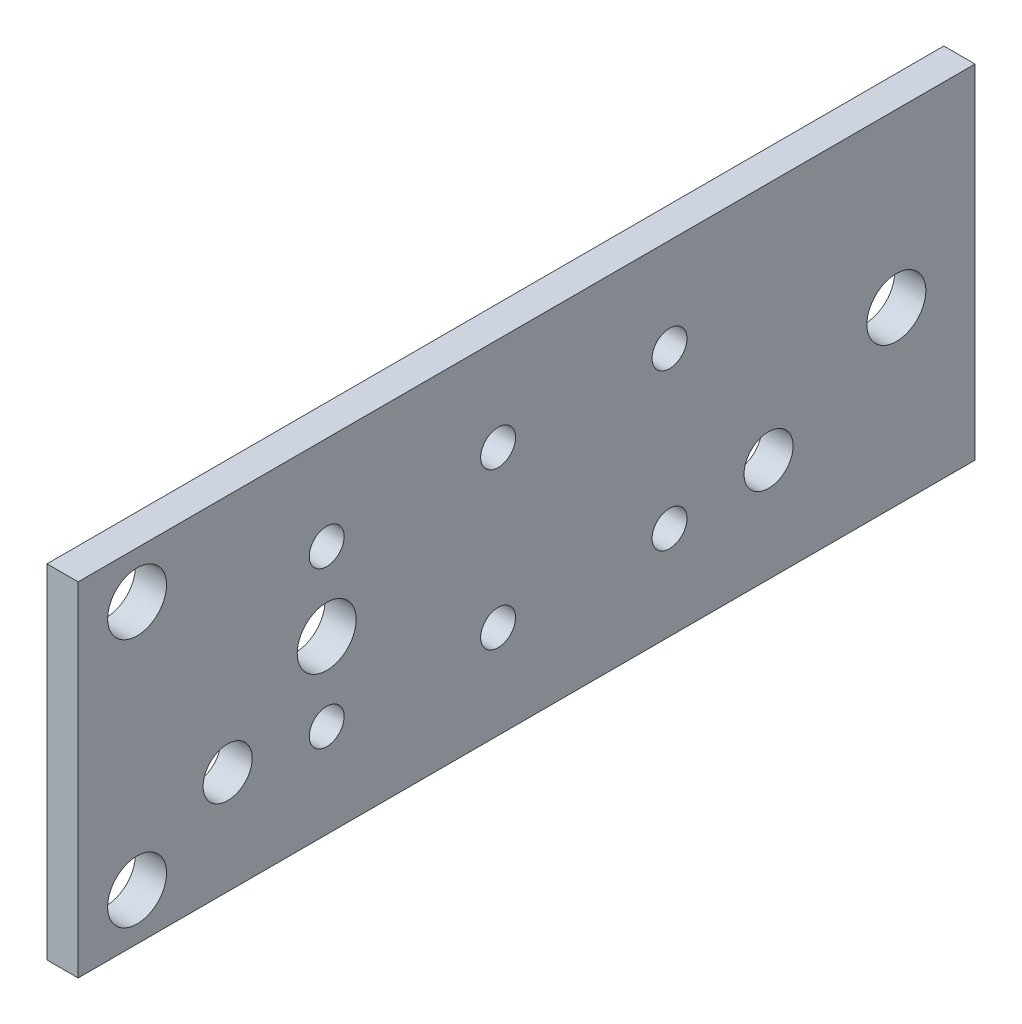
from build123d import *

# Parameters (mm, degrees)
SKETCH1_W                      = 38.1
SKETCH1_H                      = 120
BOSS_EXTRUDE1_DEPTH            = 38.1
SKETCH2_W                      = 34.925
SKETCH2_H                      = 34.925
CUT_EXTRUDE1_DEPTH             = 130.767142413
F_4_2_4_2_DIAMETER_HOLE1_D     = 4.2
F_6_0_6_DIAMETER_HOLE1_D       = 6
F_4_2_4_2_DIAMETER_HOLE2_D     = 4.2
F_4_2_4_2_DIAMETER_HOLE2_DEPTH = 38.1
F_6_0_6_DIAMETER_HOLE2_D       = 6
F_6_0_6_DIAMETER_HOLE2_DEPTH   = 38.1
F_6_0_6_DIAMETER_HOLE3_D       = 6
F_6_0_6_DIAMETER_HOLE3_DEPTH   = 38.1
F_4_2_4_2_DIAMETER_HOLE3_D     = 4.2
SKETCH15_R                     = 2.1
SKETCH15_R_2                   = 3
BOSS_EXTRUDE2_DEPTH            = 3.175
BOSS_EXTRUDE3_START            = -3.175
SKETCH16_R                     = 2.1
BOSS_EXTRUDE3_DEPTH            = 3.175
SKETCH18_W                     = 3.175
SKETCH18_H                     = 3.175
CUT_EXTRUDE2_DEPTH             = 130.767142413
CUT_EXTRUDE3_START             = -3.175
CUT_EXTRUDE3_OUTLINE_R         = 2.1
CUT_EXTRUDE3_DEPTH             = 3.175
BOSS_EXTRUDE4_START            = -3.175
BOSS_EXTRUDE4_OUTLINE_R        = 3
BOSS_EXTRUDE4_DEPTH            = 3.175
SKETCH19_R                     = 3
CUT_EXTRUDE4_DEPTH             = 121.228267267
BOSS_EXTRUDE5_START            = -3.175
SKETCH20_R                     = 2.1
SKETCH20_R_2                   = 3
BOSS_EXTRUDE5_DEPTH            = 3.175
SKETCH23_R                     = 1.778
SKETCH23_R_2                   = 2.5
CUT_EXTRUDE5_DEPTH             = 121.228267267
SKETCH24_W                     = 5
SKETCH24_H                     = 34.925
CUT_EXTRUDE6_DEPTH             = 121.228267267
CUT_EXTRUDE7_DEPTH             = 121.228267267
CUT_EXTRUDE7_DEPTH_BACK        = 121.228267267
SKETCH25_W                     = 23.7
SKETCH25_H                     = 34.925


# Read off the part's stored shape, not the designer's step: Cut-Extrude3, Boss-Extrude4
with BuildPart() as part:
    # Sketch1 → Boss-Extrude1 (new body)
    with BuildSketch(Plane.XZ.offset(34.925)):
        with Locations((15.875, -55)):
            Rectangle(SKETCH1_W, SKETCH1_H)
    extrude(amount=-BOSS_EXTRUDE1_DEPTH)

    # Sketch2 → Cut-Extrude1 (cut, through all)
    with BuildSketch(Plane(origin=(0, 0, -115), x_dir=(-1, 0, 0), z_dir=(0, 0, -1))):
        with Locations((-17.4625, -17.4625)):
            Rectangle(SKETCH2_W, SKETCH2_H)
    extrude(amount=-CUT_EXTRUDE1_DEPTH, mode=Mode.SUBTRACT)

    # Ø4.2 (4.2) Diameter Hole1 (through all)
    with Locations(Plane(origin=(0, 0, 0), x_dir=(-1, 0, 0), z_dir=(0, -1, 0))):
        with Locations((-5, 35.97), (-5, 91.03)):
            Hole(F_4_2_4_2_DIAMETER_HOLE1_D / 2)

    # Ø6.0 (6) Diameter Hole1 (through all)
    with Locations(Plane(origin=(0, 0, 0), x_dir=(-1, 0, 0), z_dir=(0, -1, 0))):
        with Locations((-22.225, 106.5), (-22.225, 46.5)):
            Hole(F_6_0_6_DIAMETER_HOLE1_D / 2)

    # Ø4.2 (4.2) Diameter Hole2
    with Locations(Plane(origin=(0, 3.175, 0), x_dir=(1, 0, 0), z_dir=(0, 1, 0))):
        with Locations((22.225, 33.5), (22.225, 93.5), (29.296067812, 100.571067812), (29.296067812, 26.428932188)):
            Hole(F_4_2_4_2_DIAMETER_HOLE2_D / 2, depth=F_4_2_4_2_DIAMETER_HOLE2_DEPTH)

    # Ø6.0 (6) Diameter Hole2
    with Locations(Plane(origin=(0, 3.175, 0), x_dir=(1, 0, 0), z_dir=(0, 1, 0))):
        with Locations((24.925, 6)):
            Hole(F_6_0_6_DIAMETER_HOLE2_D / 2, depth=F_6_0_6_DIAMETER_HOLE2_DEPTH)

    # Ø6.0 (6) Diameter Hole3
    with Locations(Plane.ZY.offset(3.175)):
        with Locations((-6, -24.925), (-106.5, -22.225), (-46.5, -22.225)):
            Hole(F_6_0_6_DIAMETER_HOLE3_D / 2, depth=F_6_0_6_DIAMETER_HOLE3_DEPTH)

    # Ø4.2 (4.2) Diameter Hole3 (through all)
    with Locations(Plane.ZY.offset(3.175)):
        with Locations((-93.5, -22.225), (-33.5, -22.225), (-35.97, -5), (-91.03, -5), (-100.571067812, -29.296067812), (-26.428932188, -29.296067812)):
            Hole(F_4_2_4_2_DIAMETER_HOLE3_D / 2)

    # Sketch15 → Boss-Extrude2 (add)
    with BuildSketch(Plane(origin=(0, 3.175, 0), x_dir=(1, 0, 0), z_dir=(0, 1, 0))):
        with Locations((29.296067812, 26.428932188)):
            Circle(SKETCH15_R)
        with Locations((29.296067812, 100.571067812)):
            Circle(SKETCH15_R)
        with Locations((22.225, 106.5)):
            Circle(SKETCH15_R_2)
        with Locations((22.225, 46.5)):
            Circle(SKETCH15_R_2)
        with Locations((5, 35.97)):
            Circle(SKETCH15_R)
        with Locations((5, 91.03)):
            Circle(SKETCH15_R)
    extrude(amount=-BOSS_EXTRUDE2_DEPTH)

    # Sketch16 → Boss-Extrude3 (add)
    with BuildSketch(Plane.ZY.offset(3.175).offset(BOSS_EXTRUDE3_START)):
        with Locations((-100.571067812, -29.296067812)):
            Circle(SKETCH16_R)
        with Locations((-26.428932188, -29.296067812)):
            Circle(SKETCH16_R)
        with Locations((-35.97, -5)):
            Circle(SKETCH16_R)
        with Locations((-91.03, -5)):
            Circle(SKETCH16_R)
    extrude(amount=BOSS_EXTRUDE3_DEPTH)

    # Sketch18 → Cut-Extrude2 (cut, through all)
    with BuildSketch(Plane.XY.offset(5)):
        with Locations((-1.5875, 1.5875)):
            Rectangle(SKETCH18_W, SKETCH18_H)
    extrude(amount=-CUT_EXTRUDE2_DEPTH, mode=Mode.SUBTRACT)


with BuildPart() as body_2:
    # of the pieces the cut leaves, the one that is kept (cut_extrude2_keep)
    add(part.part.solids().sort_by_distance((-3.175, -34.925, -115))[0])

    # Cut-Extrude3 outline → Cut-Extrude3 (cut)
    with BuildSketch(Plane.YZ.offset(CUT_EXTRUDE3_START)):
        with Locations((-5, -91.03)):
            Circle(CUT_EXTRUDE3_OUTLINE_R)
        with Locations((-5, -35.97)):
            Circle(CUT_EXTRUDE3_OUTLINE_R)
        with Locations((-29.296067812, -26.428932188)):
            Circle(CUT_EXTRUDE3_OUTLINE_R)
        with Locations((-29.296067812, -100.571067812)):
            Circle(CUT_EXTRUDE3_OUTLINE_R)
    extrude(amount=CUT_EXTRUDE3_DEPTH, mode=Mode.SUBTRACT)

    # Boss-Extrude4 outline → Boss-Extrude4 (add)
    with BuildSketch(Plane.YZ.offset(BOSS_EXTRUDE4_START)):
        with Locations((-22.225, -46.5)):
            Circle(BOSS_EXTRUDE4_OUTLINE_R)
        with Locations((-22.225, -106.5)):
            Circle(BOSS_EXTRUDE4_OUTLINE_R)
        with Locations((-24.925, -6)):
            Circle(BOSS_EXTRUDE4_OUTLINE_R)
    extrude(amount=BOSS_EXTRUDE4_DEPTH)

    # Sketch19 → Cut-Extrude4 (cut, through all)
    with BuildSketch(Plane.ZY.offset(3.175)):
        with Locations((-6, -4.7625)):
            Circle(SKETCH19_R)
        with Locations((-6, -30.1625)):
            Circle(SKETCH19_R)
        with Locations((-25.3, -17.4625)):
            Circle(SKETCH19_R)
        with Locations((-83.29, -17.4625)):
            Circle(SKETCH19_R)
    extrude(amount=-CUT_EXTRUDE4_DEPTH, mode=Mode.SUBTRACT)

    # Sketch20 → Boss-Extrude5 (add)
    with BuildSketch(Plane(origin=(0, 0, 0), x_dir=(0, 0, -1), z_dir=(1, 0, 0)).offset(BOSS_EXTRUDE5_START)):
        with Locations((26.428932188, -29.296067812)):
            Circle(SKETCH20_R)
        with Locations((33.8, -17.4625)):
            Circle(SKETCH20_R_2)
        with Locations((33.5, -22.225)):
            Circle(SKETCH20_R)
        with Locations((35.97, -5)):
            Circle(SKETCH20_R)
        with Locations((91.03, -5)):
            Circle(SKETCH20_R)
        with Locations((93.8, -17.4625)):
            Circle(SKETCH20_R_2)
        with Locations((93.5, -22.225)):
            Circle(SKETCH20_R)
        with Locations((100.571067812, -29.296067812)):
            Circle(SKETCH20_R)
    extrude(amount=BOSS_EXTRUDE5_DEPTH)

    # Sketch23 → Cut-Extrude5 (cut, through all)
    with BuildSketch(Plane(origin=(0, 0, 0), x_dir=(0, 0, -1), z_dir=(1, 0, 0))):
        with Locations((42.75, -9.525)):
            Circle(SKETCH23_R)
        with Locations((25.3, -9.525)):
            Circle(SKETCH23_R)
        with Locations((15.22, -24.4)):
            Circle(SKETCH23_R_2)
        with Locations((25.3, -25.4)):
            Circle(SKETCH23_R)
        with Locations((42.75, -25.4)):
            Circle(SKETCH23_R)
        with Locations((60.2, -9.525)):
            Circle(SKETCH23_R)
        with Locations((60.2, -25.4)):
            Circle(SKETCH23_R)
        with Locations((70.28, -24.4)):
            Circle(SKETCH23_R_2)
    extrude(amount=-CUT_EXTRUDE5_DEPTH, mode=Mode.SUBTRACT)

    # Sketch24 → Cut-Extrude6 (cut, through all)
    with BuildSketch(Plane(origin=(0, 0, 0), x_dir=(0, 0, -1), z_dir=(1, 0, 0))):
        with Locations((-2.5, -17.4625)):
            Rectangle(SKETCH24_W, SKETCH24_H)
    extrude(amount=-CUT_EXTRUDE6_DEPTH, mode=Mode.SUBTRACT)

    # Sketch25 → Cut-Extrude7 (cut, two sides: drawn at the far end of the back side and taken through both)
    with BuildSketch(Plane(origin=(0, 0, 0), x_dir=(0, 0, -1), z_dir=(1, 0, 0)).offset(-CUT_EXTRUDE7_DEPTH_BACK)):
        with Locations((103.15, -17.4625)):
            Rectangle(SKETCH25_W, SKETCH25_H)
    extrude(amount=CUT_EXTRUDE7_DEPTH + CUT_EXTRUDE7_DEPTH_BACK, mode=Mode.SUBTRACT)


solid = body_2.part
